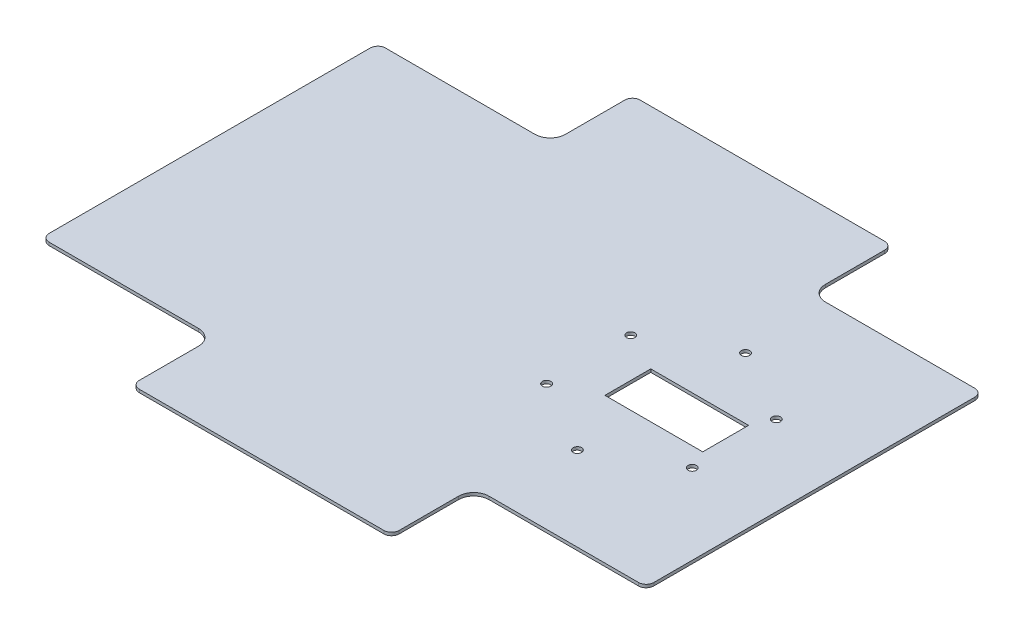
from build123d import *

# Parameters (mm, degrees)
EXTRUDE_1_DEPTH     = 2
SKETCH_4_R          = 2.75
SKETCH_4_W          = 64
SKETCH_4_H          = 30
CUT_EXTRUDE_1_DEPTH = 257.804736208


with BuildPart() as part:
    # Эскиз1 → Бобышка-Вытянуть1 (new body)
    with BuildSketch(Plane(origin=(0, 0, 0), x_dir=(1, 0, 0), z_dir=(0, 1, 0))):
        with BuildLine():
            ThreePointArc((-85, -158.805454142), (-83.535533906, -162.340988048), (-80, -163.805454142))
            Line((-80, -163.805454142), (80, -163.805454142))
            ThreePointArc((80, -163.805454142), (83.535533906, -162.340988048), (85, -158.805454142))
            Line((85, -158.805454142), (85, -120))
            ThreePointArc((85, -120), (87.928932188, -112.928932188), (95, -110))
            Line((95, -110), (192.768667216, -110))
            ThreePointArc((192.768667216, -110), (196.304201122, -108.535533906), (197.768667216, -105))
            Line((197.768667216, -105), (197.768667216, 105))
            ThreePointArc((197.768667216, 105), (196.304201122, 108.535533906), (192.768667216, 110))
            Line((192.768667216, 110), (95, 110))
            ThreePointArc((95, 110), (87.928932188, 112.928932188), (85, 120))
            Line((85, 120), (85, 158.805454142))
            ThreePointArc((85, 158.805454142), (83.535533906, 162.340988048), (80, 163.805454142))
            Line((80, 163.805454142), (-80, 163.805454142))
            ThreePointArc((-80, 163.805454142), (-83.535533906, 162.340988048), (-85, 158.805454142))
            Line((-85, 158.805454142), (-85, 120))
            ThreePointArc((-85, 120), (-87.928932188, 112.928932188), (-95, 110))
            Line((-95, 110), (-192.768667216, 110))
            ThreePointArc((-192.768667216, 110), (-196.304201122, 108.535533906), (-197.768667216, 105))
            Line((-197.768667216, 105), (-197.768667216, -105))
            ThreePointArc((-197.768667216, -105), (-196.304201122, -108.535533906), (-192.768667216, -110))
            Line((-192.768667216, -110), (-95, -110))
            ThreePointArc((-95, -110), (-87.928932188, -112.928932188), (-85, -120))
            Line((-85, -120), (-85, -158.805454142))
        make_face()
    extrude(amount=EXTRUDE_1_DEPTH)

    # Эскиз4 → Вырез-Вытянуть1 (cut, through all)
    with BuildSketch(Plane(origin=(0, 2, 0), x_dir=(1, 0, 0), z_dir=(0, 1, 0))):
        with Locations((97.768667216, 55)):
            Circle(SKETCH_4_R)
        with Locations((145.400064424, 27.5)):
            Circle(SKETCH_4_R)
        with Locations((145.400064424, -27.5)):
            Circle(SKETCH_4_R)
        with Locations((97.768667216, -55)):
            Circle(SKETCH_4_R)
        with Locations((50.137270008, -27.5)):
            Circle(SKETCH_4_R)
        with Locations((50.137270008, 27.5)):
            Circle(SKETCH_4_R)
        with Locations((107.768667216, 0)):
            Rectangle(SKETCH_4_W, SKETCH_4_H)
    extrude(amount=-CUT_EXTRUDE_1_DEPTH, mode=Mode.SUBTRACT)


solid = part.part
